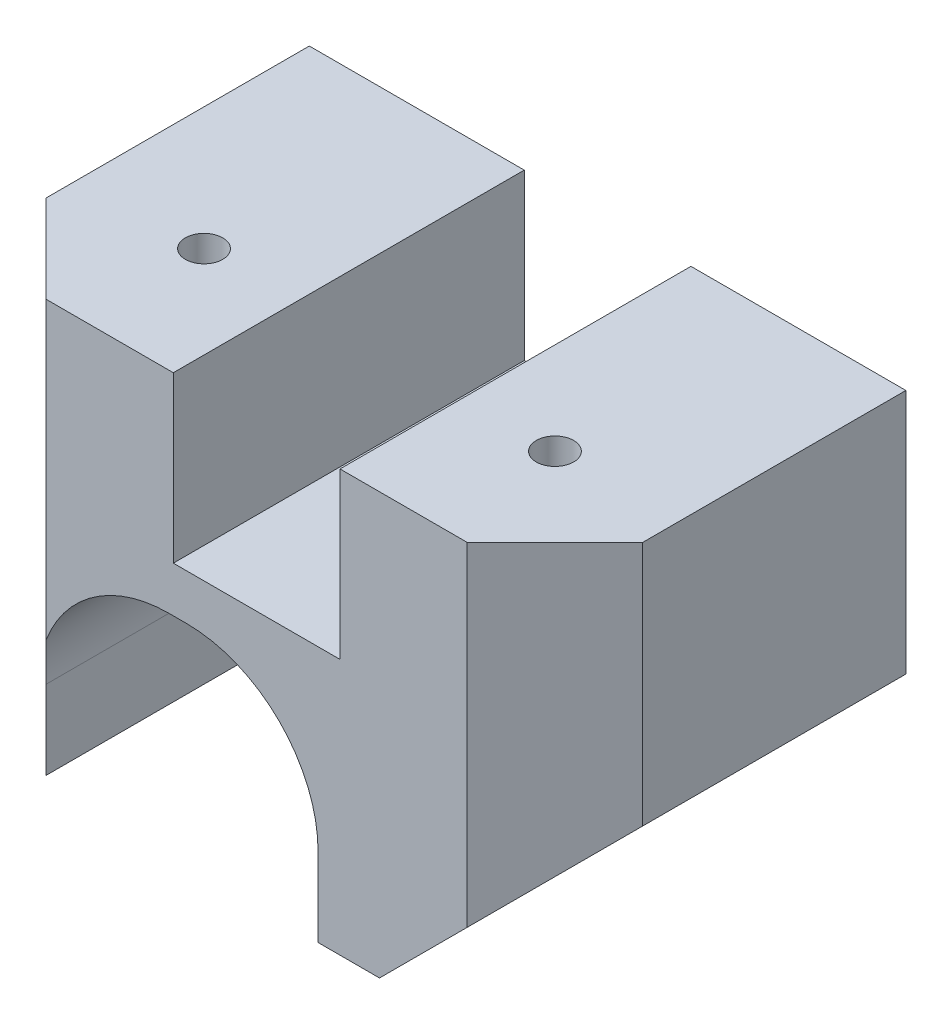
from build123d import *

# Parameters (mm, degrees)
SKETCH1_W                 = 43.18
SKETCH1_H                 = 25.4
BASE_DEPTH                = 30.48
SIDECHAMFER_SIZE          = 12.7
BACKCHAMFERS_SIZE         = 6.35
SKETCH2_W                 = 12.065
SKETCH2_H                 = 11.938
LINACTSLOT_DEPTH          = 46.169884879
MOUTINGHOLES_D            = 2.7051
MOUTINGHOLES_DEPTH        = 14.478
MOUTINGHOLES_TIP          = 0.81269403
MOTORSLOT_DEPTH           = 46.169884879
MOTORMOUNTINGHOLES2_D     = 2.2606
MOTORMOUNTINGHOLES2_DEPTH = 11.43
MOTORMOUNTINGHOLES2_TIP   = 0.679152758


with BuildPart() as part:
    # Sketch1 → Base (new body)
    with BuildSketch(Plane(origin=(0, 0, 0), x_dir=(1, 0, 0), z_dir=(0, 1, 0))):
        Rectangle(SKETCH1_W, SKETCH1_H)
    extrude(amount=BASE_DEPTH)

    # SideChamfer
    sidechamfer_edges = [part.edges().sort_by_distance(p)[0] for p in [
        (21.59, 0, 0),
    ]]
    chamfer(sidechamfer_edges, length=SIDECHAMFER_SIZE)

    # BackChamfers
    backchamfers_edges = [part.edges().sort_by_distance(p)[0] for p in [
        (-21.59, 15.24, 12.7),
        (21.59, 21.59, 12.7),
    ]]
    chamfer(backchamfers_edges, length=BACKCHAMFERS_SIZE)

    # Sketch2 → LinActSlot (cut, through all)
    with BuildSketch(Plane.XY.offset(12.7)):
        with Locations((0, 24.511)):
            Rectangle(SKETCH2_W, SKETCH2_H)
    extrude(amount=-LINACTSLOT_DEPTH, mode=Mode.SUBTRACT)

    # MoutingHoles
    with Locations(Plane(origin=(14.160350453, 30.48, 8.373414988), x_dir=(-1, 0, 0), z_dir=(0, 1, 0))):
        with Locations((1.460350453, -4.563414988), (26.860350453, -4.563414988)):
            Hole(MOUTINGHOLES_D / 2, depth=MOUTINGHOLES_DEPTH)
            with Locations((0, 0, -(MOUTINGHOLES_DEPTH + MOUTINGHOLES_TIP / 2))):  # 118° drill point
                Cone(0, MOUTINGHOLES_D / 2, MOUTINGHOLES_TIP, mode=Mode.SUBTRACT)

    # Sketch11 → MotorSlot (cut, through all)
    with BuildSketch(Plane(origin=(0, 0, -12.7), x_dir=(-1, 0, 0), z_dir=(0, 0, -1))):
        with BuildLine():
            Line((15.875, 5.08), (15.875, 5.715))
            ThreePointArc((15.875, 5.715), (13.085192091, 12.450192091), (6.35, 15.24))
            Line((6.35, 15.24), (5.08, 15.24))
            ThreePointArc((5.08, 15.24), (-1.655192091, 12.450192091), (-4.445, 5.715))
            Line((-4.445, 5.715), (-4.445, 5.08))
            Line((-4.445, 5.08), (-4.445, 0))
            Line((-4.445, 0), (15.875, 0))
            Line((15.875, 0), (15.875, 5.08))
        make_face()
    extrude(amount=-MOTORSLOT_DEPTH, mode=Mode.SUBTRACT)

    # MotorMountingHoles2
    with Locations(Plane(origin=(0, 0, -12.7), x_dir=(-1, 0, 0), z_dir=(0, 0, -1))):
        with Locations((18.215, 5.715), (-6.785, 5.715)):
            Hole(MOTORMOUNTINGHOLES2_D / 2, depth=MOTORMOUNTINGHOLES2_DEPTH)
            with Locations((0, 0, -(MOTORMOUNTINGHOLES2_DEPTH + MOTORMOUNTINGHOLES2_TIP / 2))):  # 118° drill point
                Cone(0, MOTORMOUNTINGHOLES2_D / 2, MOTORMOUNTINGHOLES2_TIP, mode=Mode.SUBTRACT)


solid = part.part
